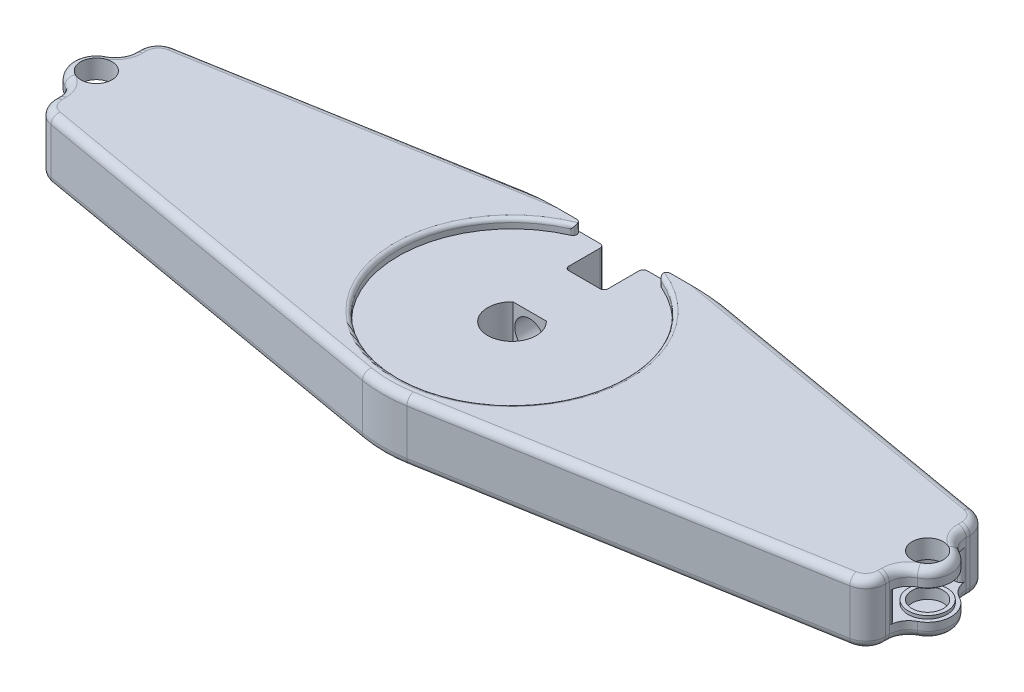
from build123d import *

# Parameters (mm, degrees)
BOSS_EXTRUDE1_DEPTH = 2
SKETCH2_R           = 2.5
BOSS_EXTRUDE2_DEPTH = 0.4
SKETCH3_R           = 2
BOSS_EXTRUDE3_DEPTH = 3
SKETCH5_R           = 2.5
BOSS_EXTRUDE4_DEPTH = 0.4
BOSS_EXTRUDE5_DEPTH = 3.8
BOSS_EXTRUDE6_DEPTH = 2
CUT_EXTRUDE1_DEPTH  = 59.965539936
CUT_EXTRUDE2_REACH  = 66.425
SKETCH8_R           = 1.9
SKETCH9_R           = 14.5
CUT_EXTRUDE3_DEPTH  = 1.2
FILLET1_R           = 0.5
SKETCH10_W          = 5
SKETCH10_H          = 6.6
CUT_EXTRUDE4_DEPTH  = 5
FILLET2_R           = 0.5
CUT_EXTRUDE5_START  = -1
SKETCH12_R          = 2
CUT_EXTRUDE5_DEPTH  = 58.96553995
FILLET4_R           = 1


# Some blends are built 0.0001 mm under size
with BuildPart() as part:
    # Sketch1 → Boss-Extrude1 (new body)
    with BuildSketch(Plane(origin=(0, 0, 0), x_dir=(1, 0, 0), z_dir=(0, 1, 0))):
        with BuildLine():
            Line((-53.07, -5.398003398), (-53.07, -4.898979486))
            ThreePointArc((-53.07, -4.898979486), (-53.437992836, -3.593397066), (-54.433636364, -2.672170628))
            ThreePointArc((-54.433636364, -2.672170628), (-56.07, 0), (-54.433636364, 2.672170628))
            ThreePointArc((-54.433636364, 2.672170628), (-53.437992836, 3.593397066), (-53.07, 4.898979486))
            Line((-53.07, 4.898979486), (-53.07, 5.398003398))
            ThreePointArc((-53.07, 5.398003398), (-52.483509318, 7.006879431), (-50.999214327, 7.860882822))
            Line((-50.999214327, 7.860882822), (-2.832814556, 16.255004205))
            ThreePointArc((-2.832814556, 16.255004205), (0, 16.5), (2.832814556, 16.255004205))
            Line((2.832814556, 16.255004205), (50.999214327, 7.860882822))
            ThreePointArc((50.999214327, 7.860882822), (52.483509318, 7.006879431), (53.07, 5.398003398))
            Line((53.07, 5.398003398), (53.07, 4.898979486))
            ThreePointArc((53.07, 4.898979486), (53.437992836, 3.593397066), (54.433636364, 2.672170628))
            ThreePointArc((54.433636364, 2.672170628), (56.07, 0), (54.433636364, -2.672170628))
            ThreePointArc((54.433636364, -2.672170628), (53.437992836, -3.593397066), (53.07, -4.898979486))
            Line((53.07, -4.898979486), (53.07, -5.398003398))
            ThreePointArc((53.07, -5.398003398), (52.483509318, -7.006879431), (50.999214327, -7.860882822))
            Line((50.999214327, -7.860882822), (2.832814556, -16.255004205))
            ThreePointArc((2.832814556, -16.255004205), (0, -16.5), (-2.832814556, -16.255004205))
            Line((-2.832814556, -16.255004205), (-50.999214327, -7.860882822))
            ThreePointArc((-50.999214327, -7.860882822), (-52.483509318, -7.006879431), (-53.07, -5.398003398))
        make_face()
        with BuildLine():
            Line((-2.132486811, 2.25), (2.132486811, 2.25))
            ThreePointArc((2.132486811, 2.25), (0, -3.1), (-2.132486811, 2.25))
        make_face(mode=Mode.SUBTRACT)
    extrude(amount=BOSS_EXTRUDE1_DEPTH)

    # Sketch2 → Boss-Extrude2 (add)
    with BuildSketch(Plane(origin=(0, 2, 0), x_dir=(1, 0, 0), z_dir=(0, 1, 0))):
        with Locations(Location((-53.07, 0, 0), (0, 0, 270))):
            Circle(SKETCH2_R)
        with Locations(Location((53.07, 0, 0), (0, 0, 270))):
            Circle(SKETCH2_R)
    extrude(amount=BOSS_EXTRUDE2_DEPTH)

    # Sketch3 → Boss-Extrude3 (add)
    with BuildSketch(Plane(origin=(0, 2.4, 0), x_dir=(1, 0, 0), z_dir=(0, 1, 0))):
        with Locations(Location((-53.07, 0, 0), (0, 0, 270))):
            Circle(SKETCH3_R)
        with Locations(Location((53.07, 0, 0), (0, 0, 270))):
            Circle(SKETCH3_R)
    extrude(amount=BOSS_EXTRUDE3_DEPTH)

    # Sketch5 → Boss-Extrude4 (add)
    with BuildSketch(Plane(origin=(0, 5.4, 0), x_dir=(1, 0, 0), z_dir=(0, 1, 0))):
        with Locations(Location((-53.07, 0, 0), (0, 0, 270))):
            Circle(SKETCH5_R)
        with Locations(Location((53.07, 0, 0), (0, 0, 270))):
            Circle(SKETCH5_R)
    extrude(amount=BOSS_EXTRUDE4_DEPTH)

    # Sketch4 → Boss-Extrude5 (add)
    with BuildSketch(Plane(origin=(0, 2, 0), x_dir=(1, 0, 0), z_dir=(0, 1, 0))):
        with BuildLine():
            Line((-53.07, 5.398003398), (-53.07, 4.898979486))
            ThreePointArc((-53.07, 4.898979486), (-53.071062452, 4.826101989), (-53.074248904, 4.753286436))
            ThreePointArc((-53.074248904, 4.753286436), (-52.95621099, 4.400491511), (-52.62719356, 4.226869108))
            ThreePointArc((-52.62719356, 4.226869108), (-48.82, 0), (-52.62719356, -4.226869108))
            ThreePointArc((-52.62719356, -4.226869108), (-52.95621099, -4.400491511), (-53.074248904, -4.753286436))
            ThreePointArc((-53.074248904, -4.753286436), (-53.071062452, -4.826101989), (-53.07, -4.898979486))
            Line((-53.07, -4.898979486), (-53.07, -5.398003398))
            ThreePointArc((-53.07, -5.398003398), (-52.483509318, -7.006879431), (-50.999214327, -7.860882822))
            Line((-50.999214327, -7.860882822), (-2.832814556, -16.255004205))
            ThreePointArc((-2.832814556, -16.255004205), (0, -16.5), (2.832814556, -16.255004205))
            Line((2.832814556, -16.255004205), (50.999214327, -7.860882822))
            ThreePointArc((50.999214327, -7.860882822), (52.483509318, -7.006879431), (53.07, -5.398003398))
            Line((53.07, -5.398003398), (53.07, -4.898979486))
            ThreePointArc((53.07, -4.898979486), (53.071062452, -4.826101989), (53.074248904, -4.753286436))
            ThreePointArc((53.074248904, -4.753286436), (52.95621099, -4.400491511), (52.62719356, -4.226869108))
            ThreePointArc((52.62719356, -4.226869108), (48.82, 0), (52.62719356, 4.226869108))
            ThreePointArc((52.62719356, 4.226869108), (52.95621099, 4.400491511), (53.074248904, 4.753286436))
            ThreePointArc((53.074248904, 4.753286436), (53.071062452, 4.826101989), (53.07, 4.898979486))
            Line((53.07, 4.898979486), (53.07, 5.398003398))
            ThreePointArc((53.07, 5.398003398), (52.483509318, 7.006879431), (50.999214327, 7.860882822))
            Line((50.999214327, 7.860882822), (2.832814556, 16.255004205))
            ThreePointArc((2.832814556, 16.255004205), (0, 16.5), (-2.832814556, 16.255004205))
            Line((-2.832814556, 16.255004205), (-50.999214327, 7.860882822))
            ThreePointArc((-50.999214327, 7.860882822), (-52.483509318, 7.006879431), (-53.07, 5.398003398))
        make_face()
        with BuildLine():
            Line((2.132486811, 2.25), (-2.132486811, 2.25))
            ThreePointArc((-2.132486811, 2.25), (0, -3.1), (2.132486811, 2.25))
        make_face(mode=Mode.SUBTRACT)
    extrude(amount=BOSS_EXTRUDE5_DEPTH)

    # Sketch6 → Boss-Extrude6 (add)
    with BuildSketch(Plane(origin=(0, 5.8, 0), x_dir=(1, 0, 0), z_dir=(0, 1, 0))):
        with BuildLine():
            Line((-2.832814556, 16.255004205), (-50.999214327, 7.860882822))
            ThreePointArc((-50.999214327, 7.860882822), (-52.483509318, 7.006879431), (-53.07, 5.398003398))
            Line((-53.07, 5.398003398), (-53.07, 4.898979486))
            ThreePointArc((-53.07, 4.898979486), (-53.437992836, 3.593397066), (-54.433636364, 2.672170628))
            ThreePointArc((-54.433636364, 2.672170628), (-56.07, 0), (-54.433636364, -2.672170628))
            ThreePointArc((-54.433636364, -2.672170628), (-53.437992836, -3.593397066), (-53.07, -4.898979486))
            Line((-53.07, -4.898979486), (-53.07, -5.398003398))
            ThreePointArc((-53.07, -5.398003398), (-52.483509318, -7.006879431), (-50.999214327, -7.860882822))
            Line((-50.999214327, -7.860882822), (-2.832814556, -16.255004205))
            ThreePointArc((-2.832814556, -16.255004205), (0, -16.5), (2.832814556, -16.255004205))
            Line((2.832814556, -16.255004205), (50.999214327, -7.860882822))
            ThreePointArc((50.999214327, -7.860882822), (52.483509318, -7.006879431), (53.07, -5.398003398))
            Line((53.07, -5.398003398), (53.07, -4.898979486))
            ThreePointArc((53.07, -4.898979486), (53.437992836, -3.593397066), (54.433636364, -2.672170628))
            ThreePointArc((54.433636364, -2.672170628), (56.07, 0), (54.433636364, 2.672170628))
            ThreePointArc((54.433636364, 2.672170628), (53.437992836, 3.593397066), (53.07, 4.898979486))
            Line((53.07, 4.898979486), (53.07, 5.398003398))
            ThreePointArc((53.07, 5.398003398), (52.483509318, 7.006879431), (50.999214327, 7.860882822))
            Line((50.999214327, 7.860882822), (2.832814556, 16.255004205))
            ThreePointArc((2.832814556, 16.255004205), (0, 16.5), (-2.832814556, 16.255004205))
        make_face()
        with BuildLine():
            Line((2.132486811, 2.25), (-2.132486811, 2.25))
            ThreePointArc((-2.132486811, 2.25), (0, -3.1), (2.132486811, 2.25))
        make_face(mode=Mode.SUBTRACT)
    extrude(amount=BOSS_EXTRUDE6_DEPTH)

    # Sketch7 → Cut-Extrude1 (cut, through all)
    with BuildSketch(Plane.XZ):
        with BuildLine():
            Line((-14.309036444, -14.255004205), (14.309036444, -14.255004205))
            Line((14.309036444, -14.255004205), (2.832814556, -16.255004205))
            ThreePointArc((2.832814556, -16.255004205), (0, -16.5), (-2.832814556, -16.255004205))
            Line((-2.832814556, -16.255004205), (-14.309036444, -14.255004205))
        make_face()
    extrude(amount=-CUT_EXTRUDE1_DEPTH, mode=Mode.SUBTRACT)

    # Sketch8 → Cut-Extrude2 (cut, up to next)
    with BuildSketch(Plane(origin=(0, 0, -14.255004205), x_dir=(-1, 0, 0), z_dir=(0, 0, -1)), mode=Mode.PRIVATE) as cut_extrude2_sk1:
        with Locations((0, 3.9)):
            Circle(SKETCH8_R)
    cut_extrude2_tool1 = extrude(cut_extrude2_sk1.sketch, amount=-CUT_EXTRUDE2_REACH, mode=Mode.PRIVATE) & part.part
    add(cut_extrude2_tool1.solids().sort_by_distance((0, 3.9, -14.255004))[0], mode=Mode.SUBTRACT)

    # Sketch9 → Cut-Extrude3 (cut)
    with BuildSketch(Plane(origin=(0, 7.8, 0), x_dir=(1, 0, 0), z_dir=(0, 1, 0))):
        Circle(SKETCH9_R)
    extrude(amount=-CUT_EXTRUDE3_DEPTH, mode=Mode.SUBTRACT)

    # Fillet1
    fillet1_edges = [part.edges().sort_by_distance(p)[0] for p in [
        (-2.654214597, 7.2, -14.255004205),
        (2.654214597, 7.2, -14.255004205),
    ]]
    fillet(fillet1_edges, radius=FILLET1_R)

    # Sketch10 → Cut-Extrude4 (cut)
    with BuildSketch(Plane(origin=(0, 0, -14.255004205), x_dir=(-1, 0, 0), z_dir=(0, 0, -1))):
        with Locations((0, 3.3)):
            Rectangle(SKETCH10_W, SKETCH10_H)
    extrude(amount=-CUT_EXTRUDE4_DEPTH, mode=Mode.SUBTRACT)

    # Fillet2
    # the kernel refuses this fillet: 0.5 mm, written as the material it adds along each edge
    with BuildSketch(Plane(origin=(2.5, 0, -9.255004205), x_dir=(-1, 0, 0), z_dir=(0, 1, 0))) as fillet2_piece_1:
        with BuildLine():
            CenterArc((FILLET2_R, -FILLET2_R), FILLET2_R, 90, 90)
            Line((0, -FILLET2_R), (0, 0))
            Line((0, 0), (FILLET2_R, 0))
        make_face()
    extrude(amount=6.6)
    with BuildSketch(Plane(origin=(-2.5, 6.6, -9.255004205), x_dir=(0, 0, -1), z_dir=(0, -1, 0))) as fillet2_piece_2:
        with BuildLine():
            CenterArc((FILLET2_R, FILLET2_R), FILLET2_R, 180, 90)
            Line((0, FILLET2_R), (0, 0))
            Line((0, 0), (FILLET2_R, 0))
        make_face()
    extrude(amount=6.6)
    # the kernel refuses this fillet: 0.5 mm, written as the material it takes off along each edge
    with BuildSketch(Plane(origin=(0, 7.8, 0), x_dir=(0.31805314745335045, 0, -0.9480728850647598), z_dir=(-0.9480728850647598, 0, -0.31805314745335045))) as fillet2_2_piece_1:
        with BuildLine():
            CenterArc((14.5 + FILLET2_R, FILLET2_R), FILLET2_R, 180, 90)
            Line((14.5 + FILLET2_R, 0), (14.5, 0))
            Line((14.5, 0), (14.5, FILLET2_R))
        make_face()
    revolve(axis=Axis((0, 7.8, 0), (0, -1, 0)), revolution_arc=322.909543442, mode=Mode.SUBTRACT)
    with BuildSketch(Plane(origin=(2.5, -1.25, -14.255004205), x_dir=(0, 0, 1), z_dir=(0, 1, 0))) as fillet2_2_piece_2:
        with BuildLine():
            CenterArc((FILLET2_R, FILLET2_R), FILLET2_R, 180, 90)
            Line((0, FILLET2_R), (0, 0))
            Line((0, 0), (FILLET2_R, 0))
        make_face()
    extrude(amount=9.1, mode=Mode.SUBTRACT)
    with BuildSketch(Plane(origin=(-2.5, 7.85, -14.255004205), x_dir=(-1, 0, 0), z_dir=(0, -1, 0))) as fillet2_2_piece_3:
        with BuildLine():
            CenterArc((FILLET2_R, -FILLET2_R), FILLET2_R, 90, 90)
            Line((0, -FILLET2_R), (0, 0))
            Line((0, 0), (FILLET2_R, 0))
        make_face()
    extrude(amount=9.1, mode=Mode.SUBTRACT)

    # Sketch12 → Cut-Extrude5 (cut, through all)
    with BuildSketch(Plane.XZ.offset(CUT_EXTRUDE5_START)):
        with Locations(Location((-53.07, 0, 0), (0, 0, 270))):
            Circle(SKETCH12_R)
        with Locations(Location((53.07, 0, 0), (0, 0, 270))):
            Circle(SKETCH12_R)
    extrude(amount=-CUT_EXTRUDE5_DEPTH, mode=Mode.SUBTRACT)

    # Fillet4
    fillet4_edges = [part.edges().sort_by_distance(p)[0] for p in [
        (-52.483509318, 7.8, -7.006879431),
        (-53.07, 7.8, -5.148491442),
        (-53.437992836, 7.8, -3.593397066),
        (-56.07, 7.8, 0),
        (-53.437992836, 7.8, 3.593397066),
        (-53.07, 7.8, 5.148491442),
        (-52.483509318, 7.8, 7.006879431),
        (-26.916014441, 7.8, 12.057943514),
        (0, 7.8, 16.5),
        (26.916014441, 7.8, 12.057943514),
        (52.483509318, 7.8, 7.006879431),
        (53.07, 7.8, 5.148491442),
        (53.437992836, 7.8, 3.593397066),
        (56.07, 7.8, 0),
        (53.437992836, 7.8, -3.593397066),
        (53.07, 7.8, -5.148491442),
        (52.483509318, 7.8, -7.006879431),
        (32.654125385, 7.8, -11.057943514),
        (-32.654125385, 7.8, -11.057943514),
        (-32.654125385, 0, -11.057943514),
        (32.654125385, 0, -11.057943514),
        (52.483509318, 0, -7.006879431),
        (53.07, 0, -5.148491442),
        (53.437992836, 0, -3.593397066),
        (56.07, 0, 0),
        (53.437992836, 0, 3.593397066),
        (53.07, 0, 5.148491442),
        (52.483509318, 0, 7.006879431),
        (26.916014441, 0, 12.057943514),
        (0, 0, 16.5),
        (-26.916014441, 0, 12.057943514),
        (-52.483509318, 0, 7.006879431),
        (-53.07, 0, 5.148491442),
        (-53.437992836, 0, 3.593397066),
        (-56.07, 0, 0),
        (-53.437992836, 0, -3.593397066),
        (-53.07, 0, -5.148491442),
        (-52.483509318, 0, -7.006879431),
    ]]
    fillet(fillet4_edges, radius=FILLET4_R - 0.0001)  # a hair under: the kernel refuses the full size


solid = part.part
